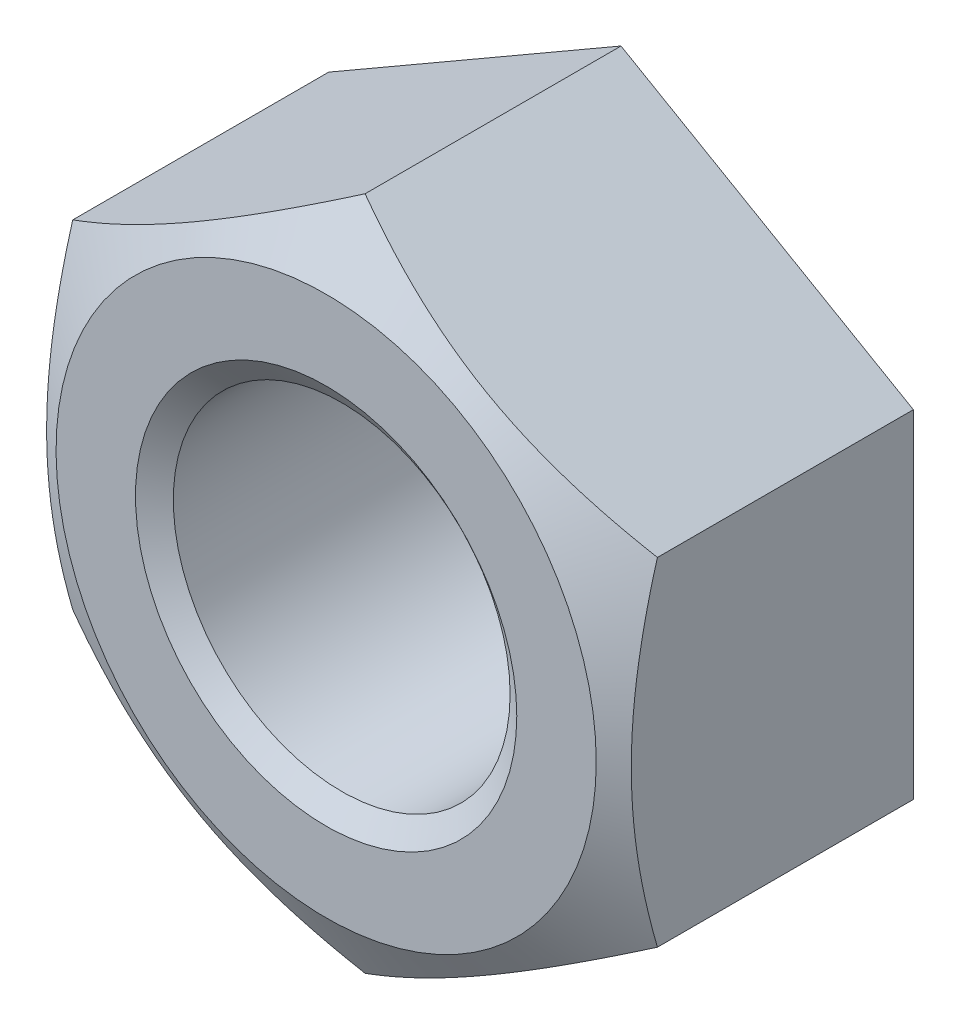
from build123d import *

# Parameters (mm, degrees)
BASENUT_START = -24
BASENUTSKE_R  = 13.25
BASENUT_DEPTH = 24
SKETCH4_W     = 0.8
SKETCH4_H     = 15.308112383


# Read off the part's stored shape, not the designer's step: ThreadSchematic
with BuildPart() as part:
    # BaseNutSke → BaseNut (new body)
    with BuildSketch(Plane.XY.offset(BASENUT_START)):
        Polygon((23, 13.279056191), (23, -13.279056191), (0, -26.558112383), (-23, -13.279056191), (-23, 13.279056191), (0, 26.558112383), align=None)
        Circle(BASENUTSKE_R, mode=Mode.SUBTRACT)
    extrude(amount=BASENUT_DEPTH)

    # Sketch5 (on Front Plane) → EndChamfer (revolve, cut)
    with BuildSketch(Plane.XY):
        Polygon((23.9746, 15), (22.626700489, 13.075), (24.0254, 13.075), (24.0254, 15), align=None)
    revolve(axis=Axis((23.9746, 15, 0), (-0.5735764363510466, -0.8191520442889915, 0)), mode=Mode.SUBTRACT)

    # Sketch4 → Bearing-Face (revolve, cut)
    with BuildSketch(Plane(origin=(0, 0, 0), x_dir=(0, 0, -1), z_dir=(1, 0, 0)), mode=Mode.PRIVATE) as bearing_face_sk:
        with Locations((23.6, 28.904056192)):
            Rectangle(SKETCH4_W, SKETCH4_H)
        Polygon((0, 21.25), (-10, 21.25), (-10, 36.558112383), (3.064640113, 36.558112383), (3.064640113, 26.558112383), align=None)
    revolve(bearing_face_sk.sketch.rotate(Axis((0, 0, 0), (0, 0, -1)), 90), axis=Axis((0, 0, 0), (0, 0, -1)), mode=Mode.SUBTRACT)

    # ThreadSchematic outline → ThreadSchematic (revolve, cut)
    with BuildSketch(Plane.XZ):
        Polygon((13.25, 0), (13.25, -1.225363192), (15, 0), align=None)
        Polygon((15, -23.9746), (13.25, -22.749236808), (13.25, -24), (15, -24), align=None)
    revolve(axis=Axis((0, 0, 0), (0, 0, 1)), mode=Mode.SUBTRACT)


solid = part.part
